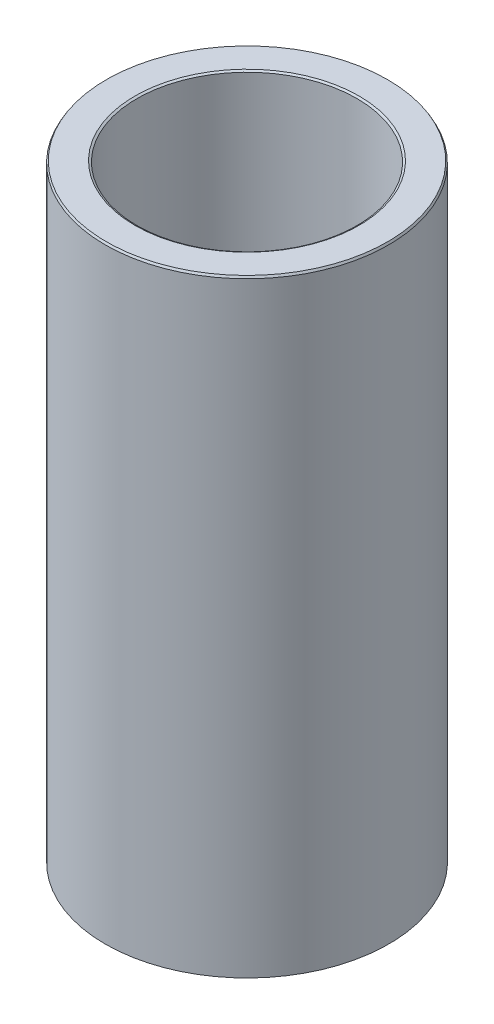
from build123d import *
from OCP.BRepFilletAPI import BRepFilletAPI_MakeChamfer

# Parameters (mm, degrees)
SKETCH1_R           = 15
BOSS_EXTRUDE1_DEPTH = 64.429645173
SKETCH2_R           = 11.645865228
CUT_EXTRUDE1_DEPTH  = 68.831992283
CHAMFER1_SIZE       = 0.216524502
CHAMFER1_SIZE2      = 0.125010479


with BuildPart() as part:
    # Sketch1 → Boss-Extrude1 (new body)
    with BuildSketch(Plane(origin=(0, 0, 0), x_dir=(1, 0, 0), z_dir=(0, 1, 0))):
        Circle(SKETCH1_R)
    extrude(amount=BOSS_EXTRUDE1_DEPTH)

    # Sketch2 → Cut-Extrude1 (cut, through all)
    with BuildSketch(Plane(origin=(0, 0, 0), x_dir=(1, 0, 0), z_dir=(0, 1, 0))):
        Circle(SKETCH2_R)
    extrude(amount=CUT_EXTRUDE1_DEPTH, mode=Mode.SUBTRACT)

    # Chamfer1: one chamfer whose edges measure the first distance from different faces: ONE call of the kernel's chamfer builder (chamfer() names one face for all edges)
    chamfer1_edges_1 = [part.edges().sort_by_distance(p)[0] for p in [
        (-11.645865228, 64.429645173, 0),
    ]]
    chamfer1_side_1 = [part.faces().sort_by_distance(p)[0] for p in [
        (-14.575735931, 64.429645173, 0),
    ]]
    chamfer1_edges_2 = [part.edges().sort_by_distance(p)[0] for p in [
        (-11.645865228, 0, 0),
    ]]
    chamfer1_side_2 = [part.faces().sort_by_distance(p)[0] for p in [
        (-11.645865228, 32.214822586, 0),
    ]]
    chamfer1_edges_3 = [part.edges().sort_by_distance(p)[0] for p in [
        (-15, 0, 0),
    ]]
    chamfer1_side_3 = [part.faces().sort_by_distance(p)[0] for p in [
        (-14.575735931, 0, 0),
    ]]
    chamfer1_edges_4 = [part.edges().sort_by_distance(p)[0] for p in [
        (-15, 64.429645173, 0),
    ]]
    chamfer1_side_4 = [part.faces().sort_by_distance(p)[0] for p in [
        (-15, 32.214822586, 0),
    ]]
    chamfer1 = BRepFilletAPI_MakeChamfer(part.part.solid().wrapped)
    for e in chamfer1_edges_1:
        chamfer1.Add(CHAMFER1_SIZE, CHAMFER1_SIZE2, e.wrapped, chamfer1_side_1[0].wrapped)  # the first distance lies on this face
    for e in chamfer1_edges_2:
        chamfer1.Add(CHAMFER1_SIZE, CHAMFER1_SIZE2, e.wrapped, chamfer1_side_2[0].wrapped)  # the first distance lies on this face
    for e in chamfer1_edges_3:
        chamfer1.Add(CHAMFER1_SIZE, CHAMFER1_SIZE2, e.wrapped, chamfer1_side_3[0].wrapped)  # the first distance lies on this face
    for e in chamfer1_edges_4:
        chamfer1.Add(CHAMFER1_SIZE, CHAMFER1_SIZE2, e.wrapped, chamfer1_side_4[0].wrapped)  # the first distance lies on this face
    add(Compound.cast(chamfer1.Shape()), mode=Mode.REPLACE)


solid = part.part
